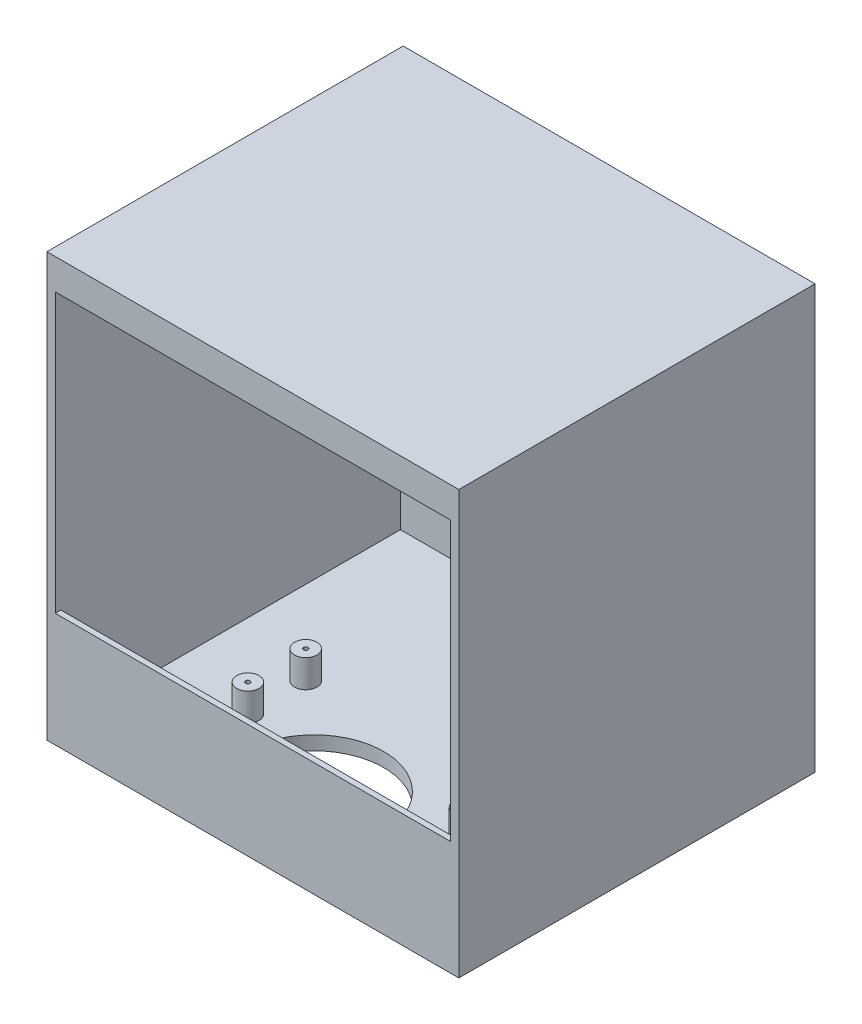
from build123d import *

# Parameters (mm, degrees)
SKETCH1_W                        = 469.9
SKETCH1_H                        = 482.6
FULL_BOX_DEPTH                   = 406.4
SKETCH2_W                        = 450.85
SKETCH2_H                        = 317.5
INSIDE_CUT_DEPTH                 = 393.7
SKETCH3_W                        = 450.85
SKETCH3_H                        = 387.35
FLOOR_CUT_DEPTH                  = 114.3
SKETCH4_R                        = 79.375
DRAIN_HOLE_DEPTH                 = 778.045169617
SKETCH5_R                        = 12.7
PEGS_DEPTH                       = 31.75
PEGS_2_DEPTH                     = 31.75
PEGS_3_DEPTH                     = 31.75
PEGS_4_DEPTH                     = 31.75
HOLES_IN_PEGS_AT_2_COUNT         = 2
HOLES_IN_PEGS_AT_2_PITCH         = 66.04
HOLES_IN_PEGS_AT_3_COUNT         = 2
HOLES_IN_PEGS_AT_3_PITCH         = 256.304124235
HOLES_IN_PEGS_AT_4_COUNT         = 2
HOLES_IN_PEGS_AT_4_PITCH         = 247.65
F_1_4_20_TAPPED_HOLE1_AT_2_COUNT = 2
F_1_4_20_TAPPED_HOLE1_AT_2_PITCH = 247.65


with BuildPart() as part:
    # Sketch1 → full box (new body)
    with BuildSketch(Plane.XY):
        with Locations((234.95, -241.3)):
            Rectangle(SKETCH1_W, SKETCH1_H)
    extrude(amount=-FULL_BOX_DEPTH)

    # Sketch2 → inside cut (cut)
    with BuildSketch(Plane.XY):
        with Locations((234.95, -193.675)):
            Rectangle(SKETCH2_W, SKETCH2_H)
    extrude(amount=-INSIDE_CUT_DEPTH, mode=Mode.SUBTRACT)

    # Sketch3 → floor cut (cut)
    with BuildSketch(Plane(origin=(0, -352.425, 0), x_dir=(1, 0, 0), z_dir=(0, 1, 0))):
        with Locations((234.95, 200.025)):
            Rectangle(SKETCH3_W, SKETCH3_H)
    extrude(amount=-FLOOR_CUT_DEPTH, mode=Mode.SUBTRACT)

    # Sketch4 → drain hole (cut, through all)
    with BuildSketch(Plane(origin=(0, -466.725, 0), x_dir=(1, 0, 0), z_dir=(0, 1, 0))):
        with Locations((219.075, 85.725)):
            Circle(SKETCH4_R)
    extrude(amount=-DRAIN_HOLE_DEPTH, mode=Mode.SUBTRACT)

    # Sketch24 → 1/4-20 Tapped Hole1 (revolve, cut)
    with BuildSketch(Plane(origin=(104.775, -466.725, -361.95), x_dir=(0, 0, 1), z_dir=(1, 0, 0))):
        Polygon((0, 0), (0, 18.043816902), (2.5527, 16.51), (2.5527, 0), align=None)
    f_1_4_20_tapped_hole1 = revolve(axis=Axis((104.775, -460.375, -361.95), (0, -1, 0)), mode=Mode.SUBTRACT)

    # 1/4-20 Tapped Hole1 at 2: 1/4-20 Tapped Hole1 ×2
    with Locations(*[(i * F_1_4_20_TAPPED_HOLE1_AT_2_PITCH, 0, 0) for i in range(1, F_1_4_20_TAPPED_HOLE1_AT_2_COUNT)]):
        add(f_1_4_20_tapped_hole1, mode=Mode.SUBTRACT)


with BuildPart() as body_2:
    # Sketch5 → pegs (new body)
    with BuildSketch(Plane(origin=(0, -466.725, 0), x_dir=(1, 0, 0), z_dir=(0, 1, 0))):
        with Locations((104.775, 124.46)):
            Circle(SKETCH5_R)
    extrude(amount=PEGS_DEPTH)

    # Sketch19 → holes in pegs (revolve, cut)
    with BuildSketch(Plane(origin=(104.775, -434.975, -124.46), x_dir=(0, 0, 1), z_dir=(1, 0, 0))):
        Polygon((0, 0), (0, 20.583816902), (2.5527, 19.05), (2.5527, 0), align=None)
    holes_in_pegs = revolve(axis=Axis((104.775, -428.625, -124.46), (0, -1, 0)), mode=Mode.SUBTRACT)


with BuildPart() as body_3:
    # Sketch5 → pegs 2 (new body)
    with BuildSketch(Plane(origin=(0, -466.725, 0), x_dir=(1, 0, 0), z_dir=(0, 1, 0))):
        with Locations((352.425, 124.46)):
            Circle(SKETCH5_R)
    extrude(amount=PEGS_2_DEPTH)

    # holes in pegs at 4: holes in pegs ×2
    with Locations(*[(i * HOLES_IN_PEGS_AT_4_PITCH, 0, 0) for i in range(1, HOLES_IN_PEGS_AT_4_COUNT)]):
        add(holes_in_pegs, mode=Mode.SUBTRACT)


with BuildPart() as body_4:
    # Sketch5 → pegs 3 (new body)
    with BuildSketch(Plane(origin=(0, -466.725, 0), x_dir=(1, 0, 0), z_dir=(0, 1, 0))):
        with Locations((352.425, 190.5)):
            Circle(SKETCH5_R)
    extrude(amount=PEGS_3_DEPTH)

    # holes in pegs at 3: holes in pegs ×2
    with Locations(*[Vector(0.9662349396012463, 0, -0.2576626505603324) * (i * HOLES_IN_PEGS_AT_3_PITCH) for i in range(1, HOLES_IN_PEGS_AT_3_COUNT)]):
        add(holes_in_pegs, mode=Mode.SUBTRACT)


with BuildPart() as body_5:
    # Sketch5 → pegs 4 (new body)
    with BuildSketch(Plane(origin=(0, -466.725, 0), x_dir=(1, 0, 0), z_dir=(0, 1, 0))):
        with Locations((104.775, 190.5)):
            Circle(SKETCH5_R)
    extrude(amount=PEGS_4_DEPTH)

    # holes in pegs at 2: holes in pegs ×2
    with Locations(*[(0, 0, -i * HOLES_IN_PEGS_AT_2_PITCH) for i in range(1, HOLES_IN_PEGS_AT_2_COUNT)]):
        add(holes_in_pegs, mode=Mode.SUBTRACT)


solid = Compound([part.part, body_2.part, body_3.part, body_4.part, body_5.part])
